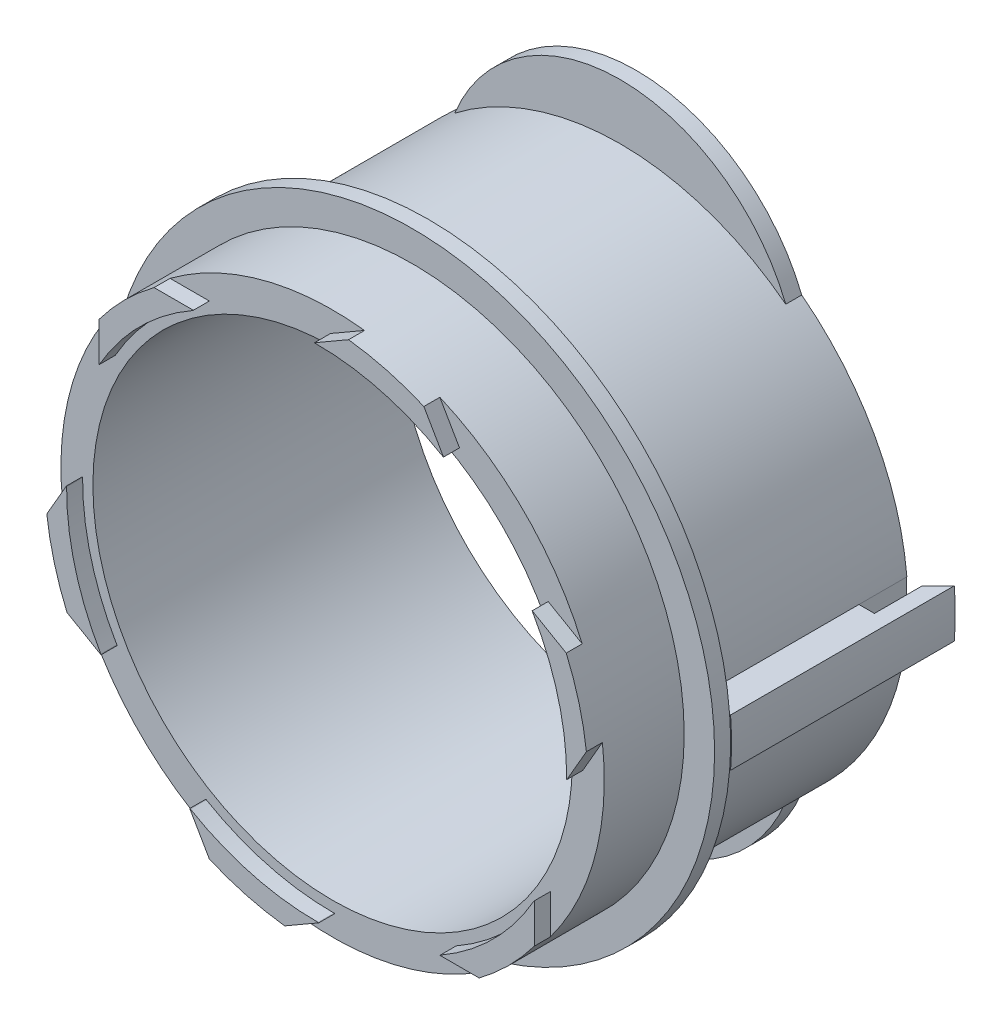
from build123d import *
from OCP.BRepAlgoAPI import BRepAlgoAPI_Cut
from OCP.TopTools import TopTools_ListOfShape
from build123d.topology import SkipClean

# Parameters (mm, degrees)
SKETCH1_R           = 17
BOSS_EXTRUDE1_DEPTH = 19
BOSS_EXTRUDE3_DEPTH = 1
CIRPATTERN1_COUNT   = 6
BOSS_EXTRUDE4_START = -13
BOSS_EXTRUDE4_DEPTH = 14
CUT_EXTRUDE3_START  = -4
CUT_EXTRUDE3_DEPTH  = 4
CHAMFER1_SIZE       = 1
MIRROR1_START       = -1
MIRROR1_DEPTH       = 4
MIRROR1_START_2     = 3
MIRROR1_2_DEPTH     = 10
MIRROR1_3_DEPTH     = 3
MIRROR1_4_DEPTH     = 10
MIRROR1_5_DEPTH     = 1
MIRROR1_START_3     = 11.973929824
MIRROR1_6_OUTLINE_W = 2.659800733000001
MIRROR1_6_OUTLINE_H = 4.5
MIRROR1_6_DEPTH     = 2.142099975
SKETCH7_R           = 18.903661893109657
BOSS_EXTRUDE5_DEPTH = 1
BOSS_EXTRUDE7_DEPTH = 1
SKETCH2_R           = 15.000000000000002
CUT_EXTRUDE5_DEPTH  = 39


with BuildPart() as part:
    # Sketch1 → Boss-Extrude1 (new body)
    with BuildSketch(Plane.XY):
        Circle(SKETCH1_R)
    extrude(amount=BOSS_EXTRUDE1_DEPTH)

    # Sketch4 → Boss-Extrude3 (add)
    with SkipClean():  # the faces are left unmerged after this step: merging them gives an invalid solid
        with BuildSketch(Plane.XY.offset(19)):
            with BuildLine():
                Line((-10.170952539104004, 13.621737203723095), (-7.713345385435483, 13.621737203723095))
                Line((-7.713345385435483, 13.621737203723095), (-7.736883673253982, 13.598198915904591))
                ThreePointArc((-7.736883673253982, 13.598198915904591), (-11.062784069346495, 11.062784069346478), (-13.598198915904605, 7.736883673253956))
                Line((-13.598198915904605, 7.736883673253956), (-13.621737203723118, 7.7133453854354475))
                Line((-13.621737203723118, 7.7133453854354475), (-13.621737203723118, 10.17095253910397))
                ThreePointArc((-13.621737203723118, 10.17095253910397), (-12.020815280171325, 12.020815280171297), (-10.170952539104004, 13.621737203723095))
            make_face()
        boss_extrude3 = extrude(amount=BOSS_EXTRUDE3_DEPTH)

    # CirPattern1: Boss-Extrude3 ×6 about axis
    with SkipClean():  # the faces are left unmerged after this step: merging them gives an invalid solid
        cirpattern1_axis = Axis((-2.8e-16, 1e-17, 0), (0, 0, 1))
        for i in range(1, CIRPATTERN1_COUNT):
            add(boss_extrude3.rotate(cirpattern1_axis, i * 360 / CIRPATTERN1_COUNT))

    # Sketch5 → Boss-Extrude4 (add)
    with SkipClean():  # the faces are left unmerged after this step: merging them gives an invalid solid
        with BuildSketch(Plane(origin=(0, 0, 0), x_dir=(-1, 0, 0), z_dir=(0, 0, -1)).offset(BOSS_EXTRUDE4_START)):
            with BuildLine():
                Line((16.903661893109657, 1.5), (18.903661893109657, 1.5))
                ThreePointArc((18.903661893109657, 1.5), (18.963080787915402, 0), (18.903661893109657, -1.5))
                Line((18.903661893109657, -1.5), (16.903661893109657, -1.5))
                Line((16.903661893109657, -1.5), (16.903661893109657, 1.5))
            make_face()
        extrude(amount=BOSS_EXTRUDE4_DEPTH)


with BuildPart() as cut_extrude3_tool:
    # Cut-Extrude3: read off the stored shape, not the designer's step
    # Cut-Extrude3 outline → Cut-Extrude3 (new body)
    with BuildSketch(Plane(origin=(0, 0, -1), x_dir=(-1, 0, 0), z_dir=(0, 0, -1)).offset(CUT_EXTRUDE3_START)):
        Polygon((17.903661893, 1.5), (16.903661893, 1.500007564), (16.903661893, -1.5), (17.903661893, -1.5), align=None)
    extrude(amount=CUT_EXTRUDE3_DEPTH)


with BuildPart() as part_1:
    add(part.part)

    # Cut-Extrude3: cut by cut_extrude3_tool, with a tolerance
    cut_extrude3_stock = TopTools_ListOfShape()
    cut_extrude3_stock.Append(part_1.part.wrapped)
    cut_extrude3_tools = TopTools_ListOfShape()
    cut_extrude3_tools.Append(cut_extrude3_tool.part.wrapped)
    cut_extrude3_cut = BRepAlgoAPI_Cut()
    cut_extrude3_cut.SetArguments(cut_extrude3_stock)
    cut_extrude3_cut.SetTools(cut_extrude3_tools)
    cut_extrude3_cut.SetFuzzyValue(0.00001)
    cut_extrude3_cut.Build()
    add(Compound.cast(cut_extrude3_cut.Shape()).solids(), mode=Mode.REPLACE)

    # Chamfer1
    chamfer1_edges = [part_1.edges().sort_by_distance(p)[0] for p in [
        (-17.903661893, 0, -1),
    ]]
    chamfer(chamfer1_edges, length=CHAMFER1_SIZE)


with BuildPart() as mirror1_tool:
    # Mirror1: read off the stored shape, not the designer's step
    # Mirror1 outline → Mirror1 (new body)
    with BuildSketch(Plane.XY.offset(MIRROR1_START)):
        Polygon((16.903661893, -1.5), (17.903661893, -1.5), (17.903661893, 1.5), (16.933693552, 1.5), (16.903661893, 1.500015127), align=None)
    extrude(amount=MIRROR1_DEPTH)


with BuildPart() as part_2:
    add(part_1.part)

    # Mirror1: cut by mirror1_tool, with a tolerance
    mirror1_stock = TopTools_ListOfShape()
    mirror1_stock.Append(part_2.part.wrapped)
    mirror1_tools = TopTools_ListOfShape()
    mirror1_tools.Append(mirror1_tool.part.wrapped)
    mirror1_cut = BRepAlgoAPI_Cut()
    mirror1_cut.SetArguments(mirror1_stock)
    mirror1_cut.SetTools(mirror1_tools)
    mirror1_cut.SetFuzzyValue(0.00001)
    mirror1_cut.Build()
    add(Compound.cast(mirror1_cut.Shape()).solids(), mode=Mode.REPLACE)


with BuildPart() as mirror1_2_tool:
    # Mirror1 2 outline → Mirror1 2 (new body)
    with SkipClean():  # the faces are left unmerged after this step: merging them gives an invalid solid
        with BuildSketch(Plane.XY.offset(MIRROR1_START_2)):
            Polygon((16.903661893, -1.5), (17.903661893, -1.5), (17.903661893, 1.5), (16.933693552, 1.5), (16.903661893, 1.500015127), align=None)
            with BuildLine():
                Line((17.903661893, 1.5), (17.903661893, -1.5))
                Line((17.903661893, -1.5), (18.903661893, -1.5))
                ThreePointArc((18.903661893, -1.5), (18.963080788, 0), (18.903661893, 1.5))
                Line((18.903661893, 1.5), (17.903661893, 1.5))
            make_face()
        extrude(amount=MIRROR1_2_DEPTH)


with BuildPart() as part_3:
    with SkipClean():  # the faces are left unmerged after this step: merging them gives an invalid solid
        add(part_2.part)


with BuildPart() as part_4:
    # Mirror1 2: joined with mirror1_2_tool
    with SkipClean():  # the faces are left unmerged after this step: merging them gives an invalid solid
        add(part_3.part.fuse(mirror1_2_tool.part, tol=0.00001))


with BuildPart() as mirror1_3_tool:
    # Mirror1 3 outline → Mirror1 3 (new body)
    with SkipClean():  # the faces are left unmerged after this step: merging them gives an invalid solid
        with BuildSketch(Plane.XY):
            with BuildLine():
                Line((17.903661893, 1.5), (17.903661893, -1.5))
                Line((17.903661893, -1.5), (18.903661893, -1.5))
                ThreePointArc((18.903661893, -1.5), (18.963080788, 0), (18.903661893, 1.5))
                Line((18.903661893, 1.5), (17.903661893, 1.5))
            make_face()
        extrude(amount=MIRROR1_3_DEPTH)


with BuildPart() as part_5:
    with SkipClean():  # the faces are left unmerged after this step: merging them gives an invalid solid
        add(part_4.part)


with BuildPart() as part_6:
    # Mirror1 3: joined with mirror1_3_tool
    with SkipClean():  # the faces are left unmerged after this step: merging them gives an invalid solid
        add(part_5.part.fuse(mirror1_3_tool.part, tol=0.00001))


with BuildPart() as mirror1_4_tool:
    # Mirror1 4 outline → Mirror1 4 (new body)
    with SkipClean():  # the faces are left unmerged after this step: merging them gives an invalid solid
        with BuildSketch(Plane.XY.offset(MIRROR1_START_2)):
            with BuildLine():
                ThreePointArc((16.933693952, 1.500003049), (17, 1.53e-06), (16.933694222, -1.5))
                Line((16.933694222, -1.5), (18.903661893, -1.5))
                ThreePointArc((18.903661893, -1.5), (18.963080788, 0), (18.903661893, 1.5))
                Line((18.903661893, 1.5), (16.933693952, 1.500003049))
            make_face()
        extrude(amount=MIRROR1_4_DEPTH)


with BuildPart() as part_7:
    with SkipClean():  # the faces are left unmerged after this step: merging them gives an invalid solid
        add(part_6.part)


with BuildPart() as part_8:
    # Mirror1 4: joined with mirror1_4_tool
    with SkipClean():  # the faces are left unmerged after this step: merging them gives an invalid solid
        add(part_7.part.fuse(mirror1_4_tool.part, tol=0.00001))


with BuildPart() as mirror1_5_tool:
    # Mirror1 5 outline → Mirror1 5 (new body)
    with SkipClean():  # the faces are left unmerged after this step: merging them gives an invalid solid
        with BuildSketch(Plane.XY.offset(MIRROR1_START)):
            with BuildLine():
                ThreePointArc((16.933693952, 1.500003049), (17, 1.53e-06), (16.933694222, -1.5))
                Line((16.933694222, -1.5), (18.903661893, -1.5))
                ThreePointArc((18.903661893, -1.5), (18.963080788, 0), (18.903661893, 1.5))
                Line((18.903661893, 1.5), (16.933693952, 1.500003049))
            make_face()
        extrude(amount=MIRROR1_5_DEPTH)


with BuildPart() as part_9:
    with SkipClean():  # the faces are left unmerged after this step: merging them gives an invalid solid
        add(part_8.part)


with BuildPart() as part_10:
    # Mirror1 5: joined with mirror1_5_tool
    with SkipClean():  # the faces are left unmerged after this step: merging them gives an invalid solid
        add(part_9.part.fuse(mirror1_5_tool.part, tol=0.00001))


with BuildPart() as mirror1_6_tool:
    # Mirror1 6 outline → Mirror1 6 (new body)
    with BuildSketch(Plane(origin=(0, 0, 0), x_dir=(0.707106781186545, 0, 0.70710678118655), z_dir=(0.70710678118655, 0, -0.707106781186545)).offset(MIRROR1_START_3)):
        with Locations((11.3299003665, 0.75)):
            Rectangle(MIRROR1_6_OUTLINE_W, MIRROR1_6_OUTLINE_H)
    extrude(amount=MIRROR1_6_DEPTH)


with BuildPart() as part_11:
    add(part_10.part)

    # Mirror1 6: cut by mirror1_6_tool, with a tolerance
    mirror1_6_stock = TopTools_ListOfShape()
    mirror1_6_stock.Append(part_11.part.wrapped)
    mirror1_6_tools = TopTools_ListOfShape()
    mirror1_6_tools.Append(mirror1_6_tool.part.wrapped)
    mirror1_6_cut = BRepAlgoAPI_Cut()
    mirror1_6_cut.SetArguments(mirror1_6_stock)
    mirror1_6_cut.SetTools(mirror1_6_tools)
    mirror1_6_cut.SetFuzzyValue(0.00001)
    mirror1_6_cut.Build()
    add(Compound.cast(mirror1_6_cut.Shape()).solids(), mode=Mode.REPLACE)

    # Sketch7 → Boss-Extrude5 (add)
    with SkipClean():  # the faces are left unmerged after this step: merging them gives an invalid solid
        with BuildSketch(Plane.XY.offset(13)):
            with Locations(Location((0, 0, 0), (0, 0, 175.448812236))):
                Circle(SKETCH7_R)
        extrude(amount=BOSS_EXTRUDE5_DEPTH)

    # Sketch11 → Boss-Extrude7 (add)
    with SkipClean():  # the faces are left unmerged after this step: merging them gives an invalid solid
        with BuildSketch(Plane(origin=(0, 0, 0), x_dir=(-1, 0, 0), z_dir=(0, 0, -1))):
            with BuildLine():
                Line((11.160404315577848, 9.320876818848085), (11.160404315577848, -9.320876818848085))
                ThreePointArc((11.160404315577848, -9.320876818848085), (-2.05e-15, -20.481281134425934), (-11.160404315577848, -9.320876818848085))
                Line((-11.160404315577848, -9.320876818848085), (-11.160404315577848, 9.320876818848085))
                ThreePointArc((-11.160404315577848, 9.320876818848085), (6.8e-16, 20.481281134425934), (11.160404315577848, 9.320876818848085))
            make_face()
        extrude(amount=-BOSS_EXTRUDE7_DEPTH)

    # Sketch2 → Cut-Extrude5 (cut)
    with SkipClean():  # the faces are left unmerged after this step: merging them gives an invalid solid
        with BuildSketch(Plane(origin=(0, 0, 0), x_dir=(-1, 0, 0), z_dir=(0, 0, -1))):
            Circle(SKETCH2_R)
        extrude(amount=-CUT_EXTRUDE5_DEPTH, mode=Mode.SUBTRACT)


solid = part_11.part
